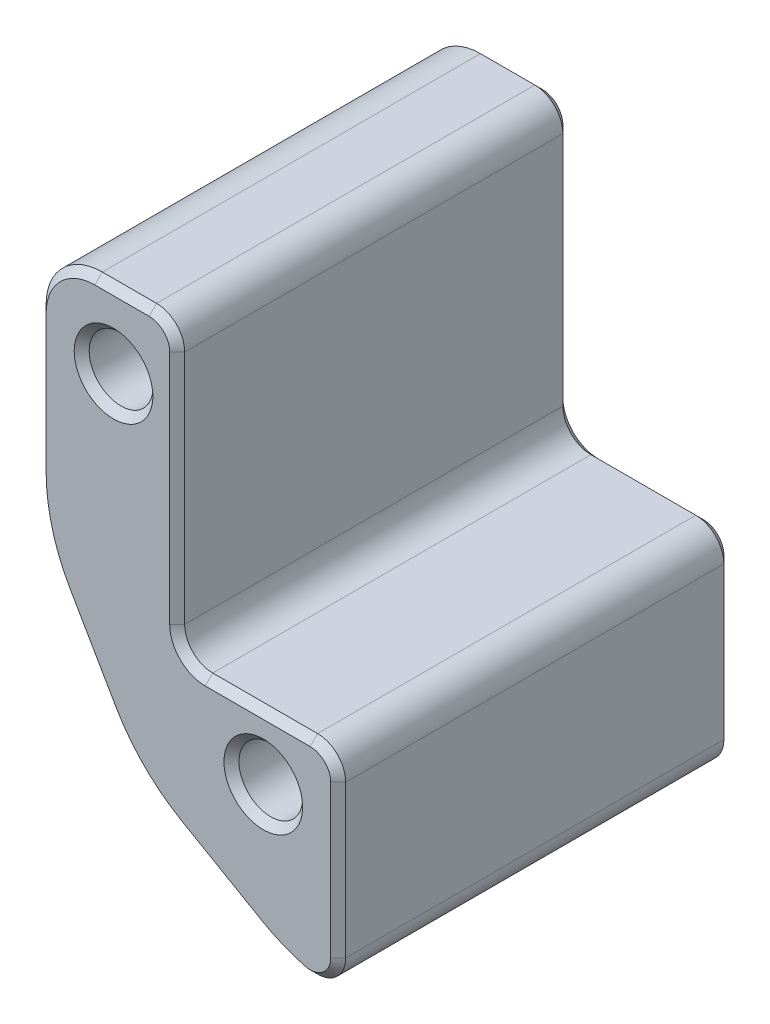
from build123d import *

# Parameters (mm, degrees)
SKETCH_2_R               = 7.1
SKETCH_2_R_2             = 6.1
EXTRUDE_1_DEPTH          = 2.2
SKETCH_2_3_R             = 9
SKETCH_2_3_R_2           = 7.1
EXTRUDE_2_DEPTH          = 4
EXTRUDE_3_DEPTH          = 4
SKETCH_4_W               = 44
SKETCH_4_H               = 27
SKETCH_4_W_2             = 38
SKETCH_4_H_2             = 21
EXTRUDE_4_DEPTH          = 4
EXTRUDE_1_2_DEPTH        = 4
DELETE_FACE_1_DEPTH      = 4
FILLET_4_R               = 0.5
FILLET_5_R               = 0.4
FILLET_6_R               = 1
SKETCH_8_R               = 2.2
EXTRUDE_7_DEPTH          = 4
CUT_EXTRUDE_1_DEPTH      = 39.832975817
CUT_EXTRUDE_1_DEPTH_BACK = 39.832975817
CUT_EXTRUDE_2_DEPTH      = 39.832975817
CUT_EXTRUDE_2_DEPTH_BACK = 39.832975817
SKETCH_9_OUTSIDE_W       = 89.4
SKETCH_9_OUTSIDE_H       = 44.4
SKETCH_9_OUTSIDE_R       = 1.7
SKETCH_9_2_R             = 1.7
EXTRUDE_8_DEPTH          = 21
FILLET_7_R               = 10
FILLET_8_R               = 3
FILLET_9_R               = 1.5
CHAMFER_1_SIZE           = 0.4


# Read off the part's stored shape, not the designer's step: 删除面1
with BuildPart() as part:
    # 草图2 → Extrude 1 (new body)
    with BuildSketch(Plane.XY):
        Circle(SKETCH_2_R)
        Circle(SKETCH_2_R_2, mode=Mode.SUBTRACT)
    extrude(amount=EXTRUDE_1_DEPTH)

    # 草图2<3> → 凸台-拉伸2 (add)
    with BuildSketch(Plane.XY):
        Circle(SKETCH_2_3_R)
        Circle(SKETCH_2_3_R_2, mode=Mode.SUBTRACT)
    extrude(amount=EXTRUDE_2_DEPTH)

    # 草图3 → 凸台-拉伸3 (add)
    with BuildSketch(Plane.XY):
        with BuildLine():
            Line((6, 6.708203932), (6, 9.5))
            Line((6, 9.5), (-6, 9.5))
            Line((-6, 9.5), (-6, 6.708203932))
            ThreePointArc((-6, 6.708203932), (0, 9), (6, 6.708203932))
        make_face()
        with BuildLine():
            Line((-6, -9.5), (6, -9.5))
            Line((6, -9.5), (6, -6.708203932))
            ThreePointArc((6, -6.708203932), (0, -9), (-6, -6.708203932))
            Line((-6, -6.708203932), (-6, -9.5))
        make_face()
    extrude(amount=EXTRUDE_3_DEPTH)



with BuildPart() as body_2:
    # 草图4 → 凸台-拉伸4 (new body)
    with BuildSketch(Plane.XY):
        with Locations((0, 0.5)):
            Rectangle(SKETCH_4_W, SKETCH_4_H)
        with Locations((0, 0.5)):
            Rectangle(SKETCH_4_W_2, SKETCH_4_H_2, mode=Mode.SUBTRACT)
    extrude(amount=EXTRUDE_4_DEPTH)


with BuildPart() as part_1:
    add(part.part)

    add(body_2.part)  # Extrude 1 2 merges body 2
    # 草图7 → Extrude 1 2 (add)
    with BuildSketch(Plane.XY):
        with BuildLine():
            ThreePointArc((19.19111663, -8.148610709), (15.188418529, -6.736776188), (10.944962783, -6.647601418))
            ThreePointArc((10.944962783, -6.647601418), (8.412688328, -7.06534444), (5.904962783, -7.611454086))
            Line((5.904962783, -7.611454086), (6.095037217, -8.388545914))
            ThreePointArc((6.095037217, -8.388545914), (8.562957594, -7.851104675), (11.055037217, -7.439992495))
            ThreePointArc((11.055037217, -7.439992495), (15.04515232, -7.523843398), (18.80888337, -8.851389291))
            Line((18.80888337, -8.851389291), (19.19111663, -8.148610709))
        make_face()
        with BuildLine():
            ThreePointArc((-18.80888337, -8.851389291), (-15.04515232, -7.523843398), (-11.055037217, -7.439992495))
            ThreePointArc((-11.055037217, -7.439992495), (-8.562957594, -7.851104675), (-6.095037217, -8.388545914))
            Line((-6.095037217, -8.388545914), (-5.904962783, -7.611454086))
            ThreePointArc((-5.904962783, -7.611454086), (-8.412688328, -7.06534444), (-10.944962783, -6.647601418))
            ThreePointArc((-10.944962783, -6.647601418), (-15.188418529, -6.736776188), (-19.19111663, -8.148610709))
            Line((-19.19111663, -8.148610709), (-18.80888337, -8.851389291))
        make_face()
        with BuildLine():
            ThreePointArc((-18.80888337, 7.148610709), (-15.04515232, 8.476156602), (-11.055037217, 8.560007505))
            ThreePointArc((-11.055037217, 8.560007505), (-8.562957594, 8.148895325), (-6.095037217, 7.611454086))
            Line((-6.095037217, 7.611454086), (-5.904962783, 8.388545914))
            ThreePointArc((-5.904962783, 8.388545914), (-8.412688328, 8.93465556), (-10.944962783, 9.352398582))
            ThreePointArc((-10.944962783, 9.352398582), (-15.188418529, 9.263223812), (-19.19111663, 7.851389291))
            Line((-19.19111663, 7.851389291), (-18.80888337, 7.148610709))
        make_face()
        with BuildLine():
            ThreePointArc((19.19111663, 7.851389291), (15.188418529, 9.263223812), (10.944962783, 9.352398582))
            ThreePointArc((10.944962783, 9.352398582), (8.412688328, 8.93465556), (5.904962783, 8.388545914))
            Line((5.904962783, 8.388545914), (6.095037217, 7.611454086))
            ThreePointArc((6.095037217, 7.611454086), (8.562957594, 8.148895325), (11.055037217, 8.560007505))
            ThreePointArc((11.055037217, 8.560007505), (15.04515232, 8.476156602), (18.80888337, 7.148610709))
            Line((18.80888337, 7.148610709), (19.19111663, 7.851389291))
        make_face()
    extrude(amount=EXTRUDE_1_2_DEPTH)

    # Delete Face 1 outline → Delete Face 1 (add)
    with BuildSketch(Plane.XY):
        with BuildLine():
            ThreePointArc((-19, 7.042506057), (-18.904671788, 7.095972847), (-18.80888337, 7.148610709))
            Line((-18.80888337, 7.148610709), (-19, 7.5))
            Line((-19, 7.5), (-19, 7.042506057))
        make_face()
        with BuildLine():
            Line((-6, 7.588108866), (-6, 8))
            Line((-6, 8), (-6.095037217, 7.611454086))
            ThreePointArc((-6.095037217, 7.611454086), (-6.047512851, 7.599804915), (-6, 7.588108866))
        make_face()
        with BuildLine():
            ThreePointArc((-19, -8.957493943), (-18.904671788, -8.904027153), (-18.80888337, -8.851389291))
            Line((-18.80888337, -8.851389291), (-19, -8.5))
            Line((-19, -8.5), (-19, -8.957493943))
        make_face()
        with BuildLine():
            Line((-6, -8.411891134), (-6, -8))
            Line((-6, -8), (-6.095037217, -8.388545914))
            ThreePointArc((-6.095037217, -8.388545914), (-6.047512851, -8.400195085), (-6, -8.411891134))
        make_face()
        with BuildLine():
            Line((6.095037217, 7.611454086), (6, 8))
            Line((6, 8), (6, 7.588108866))
            ThreePointArc((6, 7.588108866), (6.047512851, 7.599804915), (6.095037217, 7.611454086))
        make_face()
        with BuildLine():
            Line((19, 7.5), (18.80888337, 7.148610709))
            ThreePointArc((18.80888337, 7.148610709), (18.904671788, 7.095972847), (19, 7.042506057))
            Line((19, 7.042506057), (19, 7.5))
        make_face()
        with BuildLine():
            Line((6.095037217, -8.388545914), (6, -8))
            Line((6, -8), (6, -8.411891134))
            ThreePointArc((6, -8.411891134), (6.047512851, -8.400195085), (6.095037217, -8.388545914))
        make_face()
        with BuildLine():
            Line((19, -8.5), (18.80888337, -8.851389291))
            ThreePointArc((18.80888337, -8.851389291), (18.904671788, -8.904027153), (19, -8.957493943))
            Line((19, -8.957493943), (19, -8.5))
        make_face()
    extrude(amount=DELETE_FACE_1_DEPTH)

    # 圆角4
    fillet_4_edges = [part_1.edges().sort_by_distance(p)[0] for p in [
        (19, -8.046657496, 2),
        (6, -7.588305973, 2),
        (-19, -8.046657496, 2),
        (-6, -7.588305973, 2),
        (-6, 9.5, 2),
        (6, 9.5, 2),
        (6, 6.708203932, 2),
        (-6, 6.708203932, 2),
        (19, -8.957493943, 2),
        (-19, -8.957493943, 2),
        (-19, 7.042506057, 2),
        (19, 7.042506057, 2),
        (6, -6.708203932, 2),
        (-6, -6.708203932, 2),
        (-19, 7.953342504, 2),
        (19, 7.953342504, 2),
    ]]
    fillet(fillet_4_edges, radius=FILLET_4_R)

    # 圆角5
    fillet_5_edges = [part_1.edges().sort_by_distance(p)[0] for p in [
        (6, -8.411891134, 2),
        (-6, -8.411891134, 2),
        (-6, 7.588108866, 2),
        (6, 7.588108866, 2),
        (-6, -9.5, 2),
        (6, -9.5, 2),
        (-6, 8.411694027, 2),
        (-19, -10, 2),
        (19, -10, 2),
        (6, 8.411694027, 2),
    ]]
    fillet(fillet_5_edges, radius=FILLET_5_R)

    # 圆角6
    fillet_6_edges = [part_1.edges().sort_by_distance(p)[0] for p in [
        (19, 11, 2),
        (-19, 11, 2),
    ]]
    fillet(fillet_6_edges, radius=FILLET_6_R)

    # 草图8 → 凸台-拉伸7 (add)
    # profile 1 of 2: a face of its own
    with BuildSketch(Plane.XY):
        Polygon((-30.875644347, -7.875644347), (-22, -13), (-22, 14), (-36, 14), (-36, 1), align=None)
        with BuildLine():
            ThreePointArc((-22.3, 3), (-24, 1.3), (-25.7, 3))
            Line((-25.7, 3), (-25.7, 7))
            ThreePointArc((-25.7, 7), (-24, 8.7), (-22.3, 7))
            Line((-22.3, 7), (-22.3, 3))
        make_face(mode=Mode.SUBTRACT)
        with Locations((-32, 10)):
            Circle(SKETCH_8_R, mode=Mode.SUBTRACT)
    # profile 2 of 2: a face of its own
    with BuildSketch(Plane.XY):
        Polygon((22, -13), (30.875644347, -7.875644347), (36, 1), (36, 14), (22, 14), align=None)
        with BuildLine():
            Line((25.7, 7), (25.7, 3))
            ThreePointArc((25.7, 3), (24, 1.3), (22.3, 3))
            Line((22.3, 3), (22.3, 7))
            ThreePointArc((22.3, 7), (24, 8.7), (25.7, 7))
        make_face(mode=Mode.SUBTRACT)
        with Locations((32, 10)):
            Circle(SKETCH_8_R, mode=Mode.SUBTRACT)
    extrude(amount=EXTRUDE_7_DEPTH)

    # 草图8<3> → 切除-拉伸1 (cut, two sides: drawn at the far end of the back side and taken through both)
    with BuildSketch(Plane.XY.offset(-CUT_EXTRUDE_1_DEPTH_BACK)):
        with BuildLine():
            ThreePointArc((-22, -4.083484861), (-26.2, -5), (-22, -5.916515139))
            Line((-22, -5.916515139), (-22, -4.083484861))
        make_face()
        with BuildLine():
            Line((-22, -4.083484861), (-22, -5.916515139))
            ThreePointArc((-22, -5.916515139), (-21.850581474, -5.469041576), (-21.8, -5))
            ThreePointArc((-21.8, -5), (-21.850581474, -4.530958424), (-22, -4.083484861))
        make_face()
        with BuildLine():
            ThreePointArc((22, -4.083484861), (21.8, -5), (22, -5.916515139))
            Line((22, -5.916515139), (22, -4.083484861))
        make_face()
        with BuildLine():
            Line((22, -4.083484861), (22, -5.916515139))
            ThreePointArc((22, -5.916515139), (24.469041576, -7.149418526), (26.2, -5))
            ThreePointArc((26.2, -5), (24.469041576, -2.850581474), (22, -4.083484861))
        make_face()
    extrude(amount=CUT_EXTRUDE_1_DEPTH + CUT_EXTRUDE_1_DEPTH_BACK, mode=Mode.SUBTRACT)

    # 草图9 outside → 切除-拉伸2 (cut, two sides: drawn at the far end of the back side and taken through both)
    # profile 1 of 3: a face of its own
    with BuildSketch(Plane(origin=(0, 0, 0), x_dir=(-1, 0, 0), z_dir=(0, 0, -1)).offset(-CUT_EXTRUDE_2_DEPTH_BACK)):
        with Locations((0, 0.5)):
            Rectangle(SKETCH_9_OUTSIDE_W, SKETCH_9_OUTSIDE_H)
        Polygon((28.6, 14), (28.6, -1.6), (20, -1.6), (20, -13), (22, -13), (30.875644347, -7.875644347), (36, 1), (36, 14), align=None, mode=Mode.SUBTRACT)
    # profile 2 of 3: a face of its own
    with BuildSketch(Plane(origin=(0, 0, 0), x_dir=(-1, 0, 0), z_dir=(0, 0, -1)).offset(-CUT_EXTRUDE_2_DEPTH_BACK)):
        with Locations((32, 10)):
            Circle(SKETCH_9_OUTSIDE_R)
    # profile 3 of 3: a face of its own
    with BuildSketch(Plane(origin=(0, 0, 0), x_dir=(-1, 0, 0), z_dir=(0, 0, -1)).offset(-CUT_EXTRUDE_2_DEPTH_BACK)):
        with Locations((24, -5)):
            Circle(SKETCH_9_OUTSIDE_R)
    extrude(amount=CUT_EXTRUDE_2_DEPTH + CUT_EXTRUDE_2_DEPTH_BACK, mode=Mode.SUBTRACT)

    # 草图9<2> → 凸台-拉伸8 (add)
    with BuildSketch(Plane(origin=(0, 0, 0), x_dir=(-1, 0, 0), z_dir=(0, 0, -1))):
        Polygon((36, 1), (36, 14), (28.6, 14), (28.6, -1.6), (20, -1.6), (20, -13), (22, -13), (30.875644347, -7.875644347), align=None)
        with Locations((24, -5)):
            Circle(SKETCH_9_2_R, mode=Mode.SUBTRACT)
        with Locations((32, 10)):
            Circle(SKETCH_9_2_R, mode=Mode.SUBTRACT)
    extrude(amount=-EXTRUDE_8_DEPTH)

    # 圆角7
    # the kernel refuses this fillet: 10 mm, written as the material it takes off along each edge
    with BuildSketch(Plane(origin=(-36, 1, 27.698729811), x_dir=(0.5000000000000031, -0.8660254037844369, 0), z_dir=(0, 0, -1))) as fillet_7_piece_1:
        with BuildLine():
            CenterArc((FILLET_7_R * 0.267949192431, -FILLET_7_R), FILLET_7_R, 90, 30)
            Line((-FILLET_7_R * 0.232050807569, -FILLET_7_R * 0.133974596216), (-FILLET_7_R * 0.242050807569, -FILLET_7_R * 0.11665408814))
            Line((-FILLET_7_R * 0.242050807569, -FILLET_7_R * 0.11665408814), (-FILLET_7_R * 0.00535898384862, FILLET_7_R * 0.02))
            Line((-FILLET_7_R * 0.00535898384862, FILLET_7_R * 0.02), (FILLET_7_R * 0.267949192431, FILLET_7_R * 0.02))
            Line((FILLET_7_R * 0.267949192431, FILLET_7_R * 0.02), (FILLET_7_R * 0.267949192431, 0))
        make_face()
    extrude(amount=34.397459622, mode=Mode.SUBTRACT)
    with BuildSketch(Plane(origin=(-30.875644347, -7.875644347, 27.698729811), x_dir=(-0.499999999999999, 0.8660254037844392, 0), z_dir=(0, 0, -1))) as fillet_7_piece_2:
        with BuildLine():
            CenterArc((FILLET_7_R * 0.267949192431, FILLET_7_R), FILLET_7_R, 240, 30)
            Line((-FILLET_7_R * 0.232050807569, FILLET_7_R * 0.133974596216), (-FILLET_7_R * 0.242050807569, FILLET_7_R * 0.11665408814))
            Line((-FILLET_7_R * 0.242050807569, FILLET_7_R * 0.11665408814), (-FILLET_7_R * 0.00535898384862, -FILLET_7_R * 0.02))
            Line((-FILLET_7_R * 0.00535898384862, -FILLET_7_R * 0.02), (FILLET_7_R * 0.267949192431, -FILLET_7_R * 0.02))
            Line((FILLET_7_R * 0.267949192431, -FILLET_7_R * 0.02), (FILLET_7_R * 0.267949192431, 0))
        make_face()
    extrude(amount=34.397459622, mode=Mode.SUBTRACT)
    with BuildSketch(Plane(origin=(-22, -13, -6.56712034), x_dir=(1, 0, 0), z_dir=(0, 0, 1))) as fillet_7_piece_3:
        with BuildLine():
            CenterArc((2.725082782, 9.973678106), FILLET_7_R, 240, 25.841932763)
            Line((-2.274917218, 1.313424068), (-2.374917218, 1.140218987))
            Line((-2.374917218, 1.140218987), (-0.1, -0.173205081))
            Line((-0.1, -0.173205081), (0, -0.2))
            ThreePointArc((0, -0.2), (1, -0.2), (1.985498344, -0.199473562))
            Line((1.985498344, -0.199473562), (2, 0))
        make_face()
    extrude(amount=34.13424068, mode=Mode.SUBTRACT)

    # 圆角8
    fillet_8_edges = [part_1.edges().sort_by_distance(p)[0] for p in [
        (-36, 14, 10.5),
    ]]
    fillet(fillet_8_edges, radius=FILLET_8_R)

    # 圆角9
    fillet_9_edges = [part_1.edges().sort_by_distance(p)[0] for p in [
        (-28.6, -1.6, 10.5),
        (-28.6, 14, 10.5),
        (-20, -1.6, 10.5),
        (-20, -13, 10.5),
    ]]
    fillet(fillet_9_edges, radius=FILLET_9_R)

    # 倒角1
    chamfer_1_edges = [part_1.edges().sort_by_distance(p)[0] for p in [
        (-30.3, 10, 0),
        (-22.3, -5, 0),
        (-22.3, -5, 21),
        (-30.3, 10, 21),
        (-33.437822174, -3.437822174, 21),
        (-33.437822174, -3.437822174, 0),
        (-26.415026744, -10.450983121, 0),
        (-36, 7.339745962, 0),
        (-30.626204083, -7.626204083, 0),
        (-35.659258263, 1.091301473, 0),
        (-36, 7.339745962, 21),
        (-26.415026744, -10.450983121, 21),
        (-23.115886638, -12.259249594, 21),
        (-30.626204083, -7.626204083, 21),
        (-35.659258263, 1.091301473, 21),
        (-35.121320344, 13.121320344, 0),
        (-31.55, 14, 21),
        (-35.121320344, 13.121320344, 21),
        (-31.55, 14, 0),
        (-28.6, 6.2, 0),
        (-24.3, -1.6, 0),
        (-20, -7.164959535, 0),
        (-23.115886638, -12.259249594, 0),
        (-20.588680216, -12.421345211, 0),
        (-20.439339828, -2.039339828, 0),
        (-29.039339828, 13.560660172, 0),
        (-28.6, 6.2, 21),
        (-20, -7.164959535, 21),
        (-24.3, -1.6, 21),
        (-20.588680216, -12.421345211, 21),
        (-20.439339828, -2.039339828, 21),
        (-29.039339828, 13.560660172, 21),
        (-28.160660172, -1.160660172, 0),
        (-28.160660172, -1.160660172, 21),
    ]]
    chamfer(chamfer_1_edges, length=CHAMFER_1_SIZE)


solid = part_1.part
